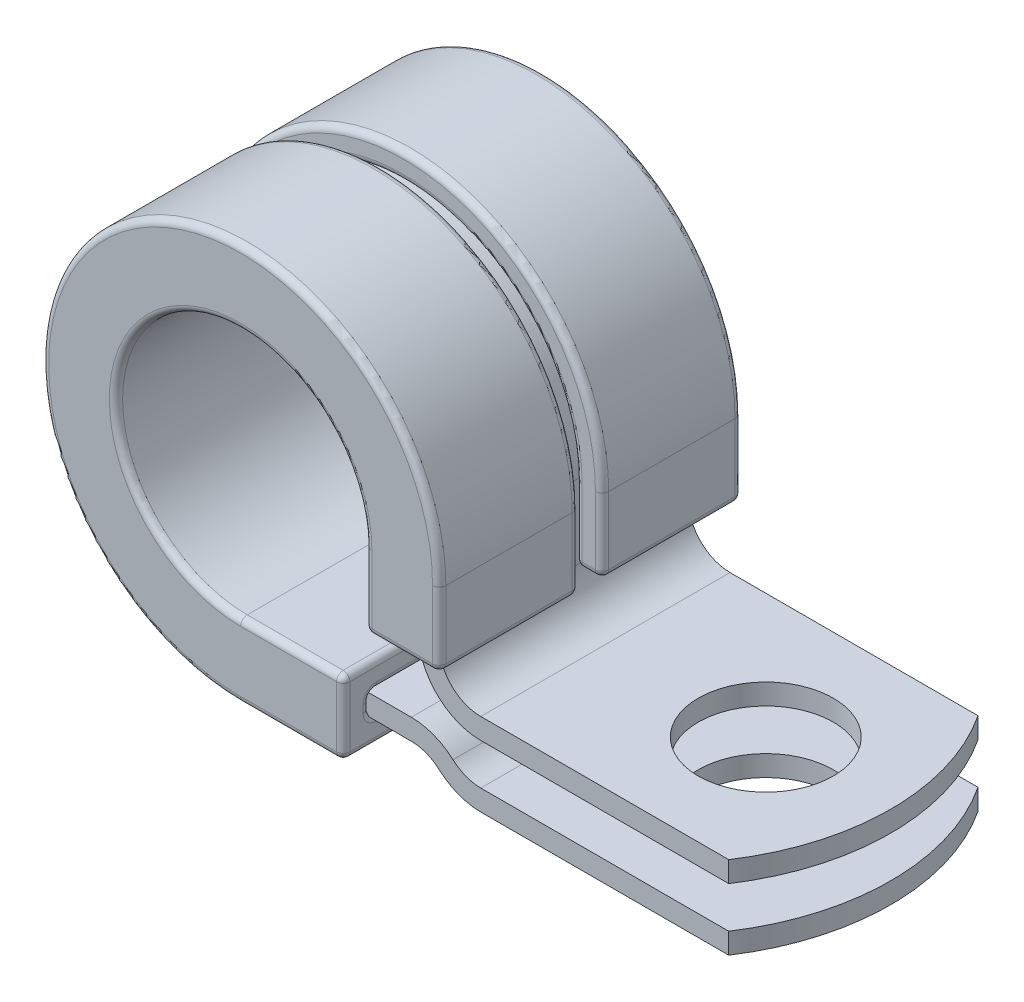
from build123d import *

# Parameters (mm, degrees)
BOSS_EXTRUDE1_DEPTH         = 4.7625
SKETCH2_R                   = 2.5796875
CUT_EXTRUDE1_DEPTH          = 22.062988288
CUT_EXTRUDE3_DEPTH          = 22.062988288
CUT_EXTRUDE3_DEPTH_BACK     = 22.062988288
BOSS_EXTRUDE2_DEPTH         = 5.7785
BOSS_EXTRUDE2_DEPTH_BACK    = 5.7785
BODY_MOVE_COPY1_START       = -2.83845
BODY_MOVE_COPY1_OUTLINE_W   = 0.79375
BODY_MOVE_COPY1_OUTLINE_H   = 9.525
BODY_MOVE_COPY1_DEPTH       = 2.83845
BODY_MOVE_COPY1_START_2     = -6.97865
BODY_MOVE_COPY1_2_OUTLINE_R = 2.5796875
BODY_MOVE_COPY1_2_DEPTH     = 0.18415
BODY_MOVE_COPY1_START_3     = -6.57225
BODY_MOVE_COPY1_3_OUTLINE_W = 0.79375
BODY_MOVE_COPY1_3_OUTLINE_H = 9.525
BODY_MOVE_COPY1_3_DEPTH     = 0.18415
BODY_MOVE_COPY1_START_4     = -5.2197
BODY_MOVE_COPY1_4_OUTLINE_R = 2.5796875
BODY_MOVE_COPY1_4_DEPTH     = 2.38125
BODY_MOVE_COPY1_START_5     = -7.58825
BODY_MOVE_COPY1_5_OUTLINE_R = 2.5796875
BODY_MOVE_COPY1_5_DEPTH     = 1.80975
BODY_MOVE_COPY1_6_OUTLINE_W = 0.79375
BODY_MOVE_COPY1_6_OUTLINE_H = 9.525
BODY_MOVE_COPY1_6_DEPTH     = 5.7785
BODY_MOVE_COPY1_START_6     = -7.028164125
BODY_MOVE_COPY1_7_OUTLINE_W = 0.79375
BODY_MOVE_COPY1_7_OUTLINE_H = 9.525
BODY_MOVE_COPY1_7_DEPTH     = 1.249664125
BODY_MOVE_COPY1_START_7     = -4.7625
BODY_MOVE_COPY1_8_DEPTH     = 9.525
BODY_MOVE_COPY1_9_DEPTH     = 9.525
CUT_EXTRUDE4_DEPTH          = 0.4445
CUT_EXTRUDE4_DEPTH_BACK     = 0.4445
FILLET1_R                   = 0.254


with BuildPart() as part:
    # Sketch1 → Boss-Extrude1 (new, symmetric)
    with BuildSketch(Plane.XY):
        with BuildLine():
            Line((0, -5.7785), (5.507912147, -5.7785))
            ThreePointArc((5.507912147, -5.7785), (6.359854046, -5.936116361), (7.099014859, -6.3881))
            ThreePointArc((7.099014859, -6.3881), (7.591788734, -6.689422426), (8.15975, -6.7945))
            Line((8.15975, -6.7945), (19.0627, -6.7945))
            Line((19.0627, -6.7945), (19.0627, -7.58825))
            Line((19.0627, -7.58825), (8.15975, -7.58825))
            ThreePointArc((8.15975, -7.58825), (7.307808101, -7.430633639), (6.568647288, -6.97865))
            ThreePointArc((6.568647288, -6.97865), (6.075873413, -6.677327574), (5.507912147, -6.57225))
            Line((5.507912147, -6.57225), (0, -6.57225))
            ThreePointArc((0, -6.57225), (-4.647282543, 4.647282543), (6.57225, 0))
            Line((6.57225, 0), (6.57225, -2.83845))
            ThreePointArc((6.57225, -2.83845), (7.037217985, -3.960982015), (8.15975, -4.42595))
            Line((8.15975, -4.42595), (19.0627, -4.42595))
            Line((19.0627, -4.42595), (19.0627, -5.2197))
            Line((19.0627, -5.2197), (8.15975, -5.2197))
            ThreePointArc((8.15975, -5.2197), (6.475951977, -4.522248023), (5.7785, -2.83845))
            Line((5.7785, -2.83845), (5.7785, 0))
            ThreePointArc((5.7785, 0), (-4.086016535, 4.086016535), (0, -5.7785))
        make_face()
    extrude(amount=BOSS_EXTRUDE1_DEPTH, both=True)

    # Sketch2 → Cut-Extrude1 (cut, through all)
    with BuildSketch(Plane(origin=(0, 0, 0), x_dir=(1, 0, 0), z_dir=(0, 1, 0))):
        with Locations(Location((14.2875, 0, 0), (0, 0, 270))):
            Circle(SKETCH2_R)
    extrude(amount=-CUT_EXTRUDE1_DEPTH, mode=Mode.SUBTRACT)

    # Sketch4 → Cut-Extrude3 (cut, two sides: drawn at the far end of the back side and taken through both)
    with BuildSketch(Plane(origin=(0, 0, 0), x_dir=(1, 0, 0), z_dir=(0, 1, 0)).offset(-CUT_EXTRUDE3_DEPTH_BACK)):
        with BuildLine():
            Line((-16.508581678, 56.545339712), (17.63395, 4.7625))
            ThreePointArc((17.63395, 4.7625), (19.0627, 0), (17.63395, -4.7625))
            Line((17.63395, -4.7625), (-16.508581678, -56.545339712))
            Line((-16.508581678, -56.545339712), (107.542616753, -56.545339712))
            Line((107.542616753, -56.545339712), (107.542616753, 56.545339712))
            Line((107.542616753, 56.545339712), (-16.508581678, 56.545339712))
        make_face()
    extrude(amount=CUT_EXTRUDE3_DEPTH + CUT_EXTRUDE3_DEPTH_BACK, mode=Mode.SUBTRACT)


with BuildPart() as body_2:
    # Sketch5 → Boss-Extrude2 (new, two sides: drawn at the far end of the back side and taken through both)
    with BuildSketch(Plane.XY.offset(-BOSS_EXTRUDE2_DEPTH_BACK)):
        with BuildLine():
            Line((4.7625, 0), (4.7625, -2.83845))
            Line((4.7625, -2.83845), (7.58825, -2.83845))
            Line((7.58825, -2.83845), (7.58825, 0))
            ThreePointArc((7.58825, 0), (-5.365703032, 5.365703032), (0, -7.58825))
            Line((0, -7.58825), (3.920412147, -7.58825))
            Line((3.920412147, -7.58825), (3.920412147, -4.7625))
            Line((3.920412147, -4.7625), (0, -4.7625))
            ThreePointArc((0, -4.7625), (-3.367596045, 3.367596045), (4.7625, 0))
        make_face()
    extrude(amount=BOSS_EXTRUDE2_DEPTH + BOSS_EXTRUDE2_DEPTH_BACK)


with BuildPart() as body_3:
    # Body-Move/Copy1: read off the stored shape, not the designer's step
    # Body-Move/Copy1 outline → Body-Move/Copy1 (new body)
    with BuildSketch(Plane(origin=(0, 0, 0), x_dir=(1, 0, 0), z_dir=(0, 1, 0)).offset(BODY_MOVE_COPY1_START)):
        with Locations((6.175375, 0)):
            Rectangle(BODY_MOVE_COPY1_OUTLINE_W, BODY_MOVE_COPY1_OUTLINE_H)
    extrude(amount=BODY_MOVE_COPY1_DEPTH)

    # Body-Move_Copy1 2 outline → Body-Move_Copy1 2 (add)
    with BuildSketch(Plane(origin=(0, 0, 0), x_dir=(1, 0, 0), z_dir=(0, 1, 0)).offset(BODY_MOVE_COPY1_START_2)):
        with BuildLine():
            Line((6.57225, -4.7625), (17.63395, -4.7625))
            ThreePointArc((17.63395, -4.7625), (19.0627, 0), (17.63395, 4.7625))
            Line((17.63395, 4.7625), (6.57225, 4.7625))
            Line((6.57225, 4.7625), (6.57225, -4.7625))
        make_face()
        with Locations((14.2875, 0)):
            Circle(BODY_MOVE_COPY1_2_OUTLINE_R, mode=Mode.SUBTRACT)
    extrude(amount=BODY_MOVE_COPY1_2_DEPTH)

    # Body-Move_Copy1 3 outline → Body-Move_Copy1 3 (add)
    with BuildSketch(Plane(origin=(0, 0, 0), x_dir=(1, 0, 0), z_dir=(0, 1, 0)).offset(BODY_MOVE_COPY1_START_3)):
        with Locations((6.175375, 0)):
            Rectangle(BODY_MOVE_COPY1_3_OUTLINE_W, BODY_MOVE_COPY1_3_OUTLINE_H)
    extrude(amount=BODY_MOVE_COPY1_3_DEPTH)

    # Body-Move_Copy1 4 outline → Body-Move_Copy1 4 (add)
    with BuildSketch(Plane(origin=(0, 0, 0), x_dir=(1, 0, 0), z_dir=(0, 1, 0)).offset(BODY_MOVE_COPY1_START_4)):
        with BuildLine():
            ThreePointArc((17.63395, -4.7625), (19.0627, 0), (17.63395, 4.7625))
            Line((17.63395, 4.7625), (5.7785, 4.7625))
            Line((5.7785, 4.7625), (5.7785, -4.7625))
            Line((5.7785, -4.7625), (17.63395, -4.7625))
        make_face()
        with Locations((14.2875, 0)):
            Circle(BODY_MOVE_COPY1_4_OUTLINE_R, mode=Mode.SUBTRACT)
    extrude(amount=BODY_MOVE_COPY1_4_DEPTH)

    # Body-Move_Copy1 5 outline → Body-Move_Copy1 5 (add)
    with BuildSketch(Plane(origin=(0, 0, 0), x_dir=(1, 0, 0), z_dir=(0, 1, 0)).offset(BODY_MOVE_COPY1_START_5)):
        with BuildLine():
            Line((6.57225, -4.7625), (17.63395, -4.7625))
            ThreePointArc((17.63395, -4.7625), (19.0627, 0), (17.63395, 4.7625))
            Line((17.63395, 4.7625), (6.57225, 4.7625))
            Line((6.57225, 4.7625), (6.57225, -4.7625))
        make_face()
        with Locations((14.2875, 0)):
            Circle(BODY_MOVE_COPY1_5_OUTLINE_R, mode=Mode.SUBTRACT)
    extrude(amount=BODY_MOVE_COPY1_5_DEPTH)

    # Body-Move_Copy1 6 outline → Body-Move_Copy1 6 (add)
    with BuildSketch(Plane(origin=(0, 0, 0), x_dir=(1, 0, 0), z_dir=(0, 1, 0))):
        with Locations((6.175375, 0)):
            Rectangle(BODY_MOVE_COPY1_6_OUTLINE_W, BODY_MOVE_COPY1_6_OUTLINE_H)
    extrude(amount=BODY_MOVE_COPY1_6_DEPTH)

    # Body-Move_Copy1 7 outline → Body-Move_Copy1 7 (add)
    with BuildSketch(Plane(origin=(0, 0, 0), x_dir=(1, 0, 0), z_dir=(0, 1, 0)).offset(BODY_MOVE_COPY1_START_6)):
        with Locations((6.175375, 0)):
            Rectangle(BODY_MOVE_COPY1_7_OUTLINE_W, BODY_MOVE_COPY1_7_OUTLINE_H)
    extrude(amount=BODY_MOVE_COPY1_7_DEPTH)

    # Body-Move_Copy1 8 outline → Body-Move_Copy1 8 (cut)
    with BuildSketch(Plane.XY.offset(BODY_MOVE_COPY1_START_7)):
        with BuildLine():
            ThreePointArc((6.57225, -2.83845), (7.037217985, -3.960982015), (8.15975, -4.42595))
            Line((8.15975, -4.42595), (21, -4.42595))
            Line((21, -4.42595), (21, -2.83845))
            Line((21, -2.83845), (6.57225, -2.83845))
        make_face()
        with BuildLine():
            ThreePointArc((5.778500001, 3.131039412), (6.370722749, 1.615042326), (6.57225, 0))
            Line((6.57225, 0), (6.57225, 5.7785))
            Line((6.57225, 5.7785), (5.7785, 5.7785))
            Line((5.7785, 5.7785), (5.778500001, 3.131039412))
        make_face()
        with BuildLine():
            Line((5.7785, -5.2197), (8.15975, -5.2197))
            ThreePointArc((8.15975, -5.2197), (6.475951977, -4.522248023), (5.7785, -2.83845))
            Line((5.7785, -2.83845), (5.7785, -5.2197))
        make_face()
        with BuildLine():
            Line((21, -6.7945), (21, -5.7785))
            Line((21, -5.7785), (5.7785, -5.7785))
            Line((5.7785, -5.7785), (5.7785, -5.793923765))
            ThreePointArc((5.7785, -5.793923765), (6.485017202, -5.988202793), (7.099014859, -6.3881))
            ThreePointArc((7.099014859, -6.3881), (7.591788734, -6.689422426), (8.15975, -6.7945))
            Line((8.15975, -6.7945), (21, -6.7945))
        make_face()
        with BuildLine():
            ThreePointArc((6.568647288, -6.97865), (6.200595269, -6.731343076), (5.7785, -6.595480694))
            Line((5.7785, -6.595480694), (5.7785, -7.028164125))
            Line((5.7785, -7.028164125), (6.57225, -7.028164125))
            Line((6.57225, -7.028164125), (6.57225, -7.58825))
            Line((6.57225, -7.58825), (8.15975, -7.58825))
            ThreePointArc((8.15975, -7.58825), (7.307808101, -7.430633639), (6.568647288, -6.97865))
        make_face()
    extrude(amount=BODY_MOVE_COPY1_8_DEPTH, mode=Mode.SUBTRACT)

    # Body-Move_Copy1 9 outline → Body-Move_Copy1 9 (add)
    with BuildSketch(Plane.XY.offset(BODY_MOVE_COPY1_START_7)):
        with BuildLine():
            Line((5.7785, 0), (5.778500001, 3.131039412))
            ThreePointArc((5.778500001, 3.131039412), (-5.646788638, 3.362773877), (0, -6.57225))
            Line((0, -6.57225), (5.507912147, -6.57225))
            ThreePointArc((5.507912147, -6.57225), (5.643703762, -6.578068336), (5.7785, -6.595480694))
            Line((5.7785, -6.595480694), (5.7785, -5.793923765))
            ThreePointArc((5.7785, -5.793923765), (5.643425688, -5.782359068), (5.507912147, -5.7785))
            Line((5.507912147, -5.7785), (0, -5.7785))
            ThreePointArc((0, -5.7785), (-4.086016535, 4.086016535), (5.7785, 0))
        make_face()
    extrude(amount=BODY_MOVE_COPY1_9_DEPTH)


with BuildPart() as body_2_1:
    add(body_2.part)

    # Combine1: cut body 3
    add(body_3.part, mode=Mode.SUBTRACT)

    # Sketch7 → Cut-Extrude4 (cut, two sides: drawn at the far end of the back side and taken through both)
    with BuildSketch(Plane.XY.offset(-CUT_EXTRUDE4_DEPTH_BACK)):
        with BuildLine():
            Line((5.7785, 0), (5.7785, -2.83845))
            Line((5.7785, -2.83845), (7.58825, -2.83845))
            Line((7.58825, -2.83845), (7.58825, 0))
            ThreePointArc((7.58825, 0), (-5.365703032, 5.365703032), (0, -7.58825))
            Line((0, -7.58825), (3.920412147, -7.58825))
            Line((3.920412147, -7.58825), (3.920412147, -5.7785))
            Line((3.920412147, -5.7785), (0, -5.7785))
            ThreePointArc((0, -5.7785), (-4.086016535, 4.086016535), (5.7785, 0))
        make_face()
    extrude(amount=CUT_EXTRUDE4_DEPTH + CUT_EXTRUDE4_DEPTH_BACK, mode=Mode.SUBTRACT)

    # Fillet1
    fillet1_edges = [body_2_1.edges().sort_by_distance(p)[0] for p in [
        (6.57225, -2.83845, -2.6035),
        (3.920412147, -6.57225, -2.6035),
        (7.58825, -2.83845, -3.1115),
        (3.920412147, -7.58825, -3.1115),
        (1.960206073, -6.57225, -0.4445),
        (-5.646788638, 3.362773877, -0.4445),
        (6.57225, -1.419225, -0.4445),
        (3.920412147, -7.08025, -0.4445),
        (3.920412147, -7.08025, 0.4445),
        (1.960206073, -7.58825, 0.4445),
        (1.960206073, -7.58825, -0.4445),
        (-5.365703032, 5.365703032, 0.4445),
        (-5.365703032, 5.365703032, -0.4445),
        (7.58825, -1.419225, 0.4445),
        (7.58825, -1.419225, -0.4445),
        (7.08025, -2.83845, 0.4445),
        (7.08025, -2.83845, -0.4445),
        (1.960206073, -6.57225, 0.4445),
        (-5.646788638, 3.362773877, 0.4445),
        (6.57225, -1.419225, 0.4445),
        (3.920412147, -4.7625, 0),
        (1.960206073, -4.7625, 5.7785),
        (3.920412147, -7.58825, 3.1115),
        (7.58825, -2.83845, 3.1115),
        (4.7625, -2.83845, 0),
        (3.920412147, -6.175375, 5.7785),
        (1.960206073, -7.58825, 5.7785),
        (-5.365703032, 5.365703032, 5.7785),
        (7.58825, -1.419225, 5.7785),
        (6.175375, -2.83845, 5.7785),
        (4.7625, -1.419225, 5.7785),
        (-3.367596045, 3.367596045, 5.7785),
        (4.7625, -1.419225, -5.7785),
        (6.175375, -2.83845, -5.7785),
        (7.58825, -1.419225, -5.7785),
        (-5.365703032, 5.365703032, -5.7785),
        (1.960206073, -7.58825, -5.7785),
        (3.920412147, -6.175375, -5.7785),
        (1.960206073, -4.7625, -5.7785),
        (-3.367596045, 3.367596045, -5.7785),
        (6.175375, -2.83845, -4.7625),
        (6.175375, -2.83845, 4.7625),
        (3.920412147, -5.7785, 0),
        (3.920412147, -6.57225, 2.6035),
        (1.960206073, -6.57225, -4.7625),
        (1.960206073, -5.7785, -4.7625),
        (1.960206073, -5.7785, 4.7625),
        (-4.086016535, 4.086016535, 4.7625),
        (5.7785, -1.419225, 4.7625),
        (6.57225, -1.419225, 4.7625),
        (-5.646788638, 3.362773877, 4.7625),
        (1.960206073, -6.57225, 4.7625),
        (3.920412147, -6.175375, 4.7625),
        (3.920412147, -6.175375, -4.7625),
        (5.7785, -2.83845, 0),
        (6.57225, -1.419225, -4.7625),
        (6.57225, -2.83845, 2.6035),
        (-5.646788638, 3.362773877, -4.7625),
        (-4.086016535, 4.086016535, -4.7625),
        (5.7785, -1.419225, -4.7625),
    ]]
    fillet(fillet1_edges, radius=FILLET1_R)


solid = Compound([part.part, body_2_1.part])
